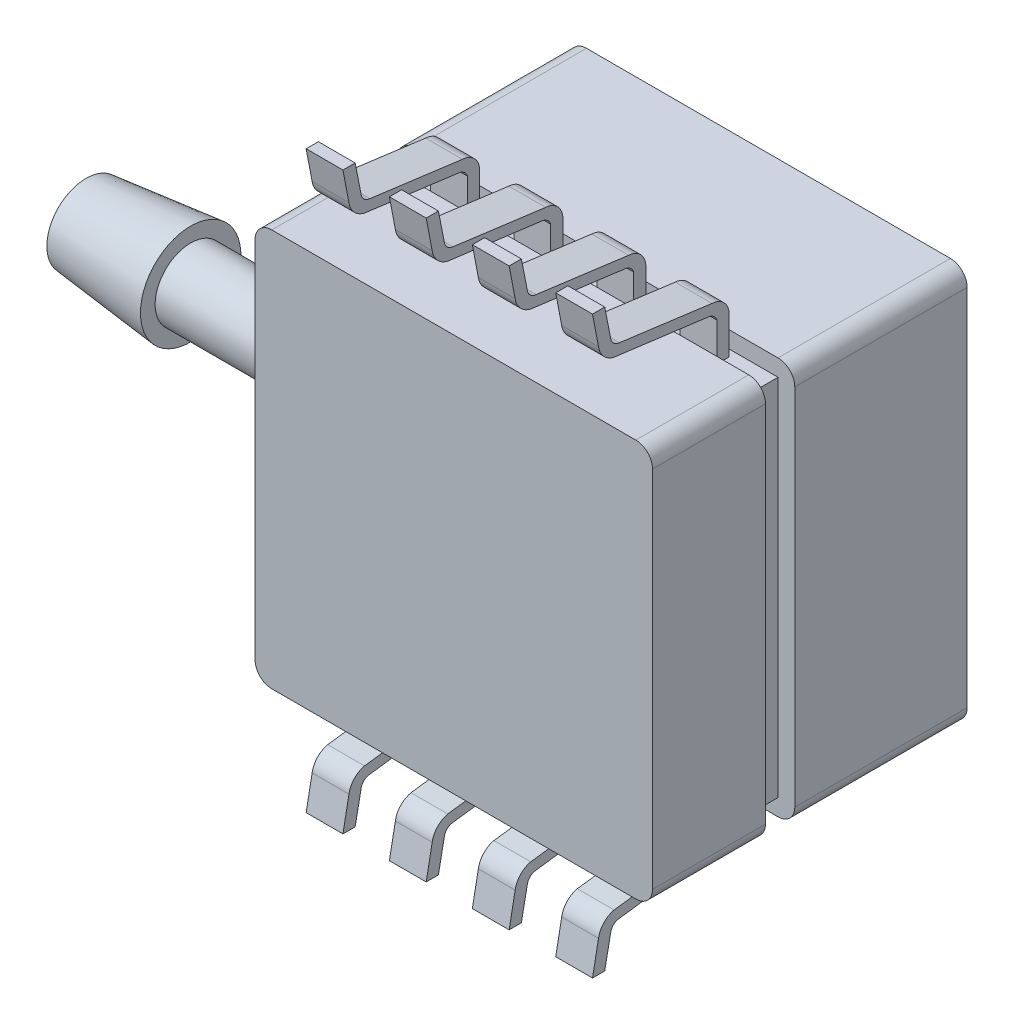
from build123d import *

# Parameters (mm, degrees)
SKETCH1_W             = 12.065
SKETCH1_H             = 12.065
BOSS_EXTRUDE1_DEPTH   = 9.5504
SKETCH3_W             = 0.508
SKETCH3_H             = 0.889
CUT_EXTRUDE1_DEPTH    = 17.527716763
SKETCH4_W             = 0.889
SKETCH4_H             = 0.508
CUT_EXTRUDE2_DEPTH    = 17.160614017
BOSS_EXTRUDE2_DEPTH   = 12.065
SKETCH6_W             = 2.010508142
SKETCH6_H             = 3.048
SKETCH6_W_2           = 1.413000982
SKETCH6_W_3           = 1.400656211
SKETCH6_W_4           = 1.409514657
SKETCH6_W_5           = 1.742646619
CUT_EXTRUDE3_DEPTH    = 15.300672912
SKETCH7_W             = 1.589030952
SKETCH7_H             = 0.369934407
SKETCH7_W_2           = 1.409514657
SKETCH7_W_3           = 1.400656211
SKETCH7_W_4           = 1.413000982
SKETCH7_W_5           = 1.782397198
CUT_EXTRUDE4_DEPTH    = 0.508
SKETCH8_W             = 1.589030952
SKETCH8_H             = 0.369934407
SKETCH8_W_2           = 1.409514657
SKETCH8_W_3           = 1.400656211
SKETCH8_W_4           = 1.413000982
SKETCH8_W_5           = 1.782397198
CUT_EXTRUDE5_DEPTH    = 0.508
FILLET1_R             = 0.508
SKETCH9_R             = 1.0795
SKETCH9_R_2           = 0.396875
BOSS_EXTRUDE3_DEPTH   = 3.175
SKETCH10_R            = 1.524
SKETCH10_R_2          = 0.396875
BOSS_EXTRUDE4_DEPTH   = 3.175
BOSS_EXTRUDE4_2_DEPTH = 3.175
CHAMFER1_SIZE         = 3.175
CHAMFER1_SIZE_2       = 0.333705947
CHAMFER2_SIZE         = 3.175
CHAMFER2_SIZE_2       = 0.333705947


with BuildPart() as part:
    # Sketch1 → Boss-Extrude1 (new body)
    with BuildSketch(Plane.XY):
        Rectangle(SKETCH1_W, SKETCH1_H)
    extrude(amount=BOSS_EXTRUDE1_DEPTH)

    # Sketch3 → Cut-Extrude1 (cut, through all)
    with BuildSketch(Plane(origin=(0, 6.0325, 0), x_dir=(1, 0, 0), z_dir=(0, 1, 0))):
        with Locations((-5.7785, -5.6769)):
            Rectangle(SKETCH3_W, SKETCH3_H)
        with Locations((5.7785, -5.6769)):
            Rectangle(SKETCH3_W, SKETCH3_H)
    extrude(amount=-CUT_EXTRUDE1_DEPTH, mode=Mode.SUBTRACT)

    # Sketch4 → Cut-Extrude2 (cut, through all)
    with BuildSketch(Plane(origin=(5.5245, 0, 0), x_dir=(0, 0, -1), z_dir=(1, 0, 0))):
        with Locations((-5.6769, 5.7785)):
            Rectangle(SKETCH4_W, SKETCH4_H)
        with Locations((-5.6769, -5.7785)):
            Rectangle(SKETCH4_W, SKETCH4_H)
    extrude(amount=-CUT_EXTRUDE2_DEPTH, mode=Mode.SUBTRACT)

    # Sketch5 → Boss-Extrude2 (add, through all)
    with BuildSketch(Plane(origin=(6.0325, 0, 0), x_dir=(0, 0, -1), z_dir=(1, 0, 0))):
        with BuildLine():
            ThreePointArc((-8.934627895, 7.265855746), (-9.249262248, 7.447228638), (-9.407747298, 7.773990618))
            Line((-9.407747298, 7.773990618), (-9.589412438, 8.72704753))
            Line((-9.589412438, 8.72704753), (-9.219352327, 8.72704753))
            Line((-9.219352327, 8.72704753), (-9.030957356, 7.773990618))
            ThreePointArc((-9.030957356, 7.773990618), (-8.934478337, 7.629789758), (-8.773302251, 7.565568589))
            Line((-8.773302251, 7.565568589), (-5.960764741, 7.193974625))
            ThreePointArc((-5.960764741, 7.193974625), (-5.591273278, 7.021604846), (-5.440761064, 6.642683921))
            Line((-5.440761064, 6.642683921), (-5.440761064, 5.5245))
            Line((-5.440761064, 5.5245), (-5.810695471, 5.5245))
            Line((-5.810695471, 5.5245), (-5.810695471, 6.676866964))
            ThreePointArc((-5.810695471, 6.676866964), (-5.915490425, 6.828747463), (-6.087415345, 6.895766048))
            Line((-6.087415345, 6.895766048), (-8.934627895, 7.265855746))
        make_face()
        with BuildLine():
            ThreePointArc((-5.440761064, -6.642683921), (-5.591273278, -7.021604846), (-5.960764741, -7.193974625))
            Line((-5.960764741, -7.193974625), (-8.773302251, -7.565568589))
            ThreePointArc((-8.773302251, -7.565568589), (-8.934478337, -7.629789758), (-9.030957356, -7.773990618))
            Line((-9.030957356, -7.773990618), (-9.219352327, -8.72704753))
            Line((-9.219352327, -8.72704753), (-9.589412438, -8.72704753))
            Line((-9.589412438, -8.72704753), (-9.407747298, -7.773990618))
            ThreePointArc((-9.407747298, -7.773990618), (-9.249262248, -7.447228638), (-8.934627895, -7.265855746))
            Line((-8.934627895, -7.265855746), (-6.087415345, -6.895766048))
            ThreePointArc((-6.087415345, -6.895766048), (-5.915490425, -6.828747463), (-5.810695471, -6.676866964))
            Line((-5.810695471, -6.676866964), (-5.810695471, -5.5245))
            Line((-5.810695471, -5.5245), (-5.440761064, -5.5245))
            Line((-5.440761064, -5.5245), (-5.440761064, -6.642683921))
        make_face()
    extrude(amount=-BOSS_EXTRUDE2_DEPTH)

    # Sketch6 → Cut-Extrude3 (cut, through all)
    with BuildSketch(Plane(origin=(0, 0, 0), x_dir=(-1, 0, 0), z_dir=(0, 0, -1))):
        with Locations((-5.255356873, 7.5565)):
            Rectangle(SKETCH6_W, SKETCH6_H)
        with Locations((-2.426002311, 7.5565)):
            Rectangle(SKETCH6_W_2, SKETCH6_H)
        with Locations((0.098426285, 7.5565)):
            Rectangle(SKETCH6_W_3, SKETCH6_H)
        with Locations((2.621111719, 7.5565)):
            Rectangle(SKETCH6_W_4, SKETCH6_H)
        with Locations((5.314792358, 7.5565)):
            Rectangle(SKETCH6_W_5, SKETCH6_H)
        with Locations((5.314792358, -7.5565)):
            Rectangle(SKETCH6_W_5, SKETCH6_H)
        with Locations((2.621111719, -7.5565)):
            Rectangle(SKETCH6_W_4, SKETCH6_H)
        with Locations((0.098426285, -7.5565)):
            Rectangle(SKETCH6_W_3, SKETCH6_H)
        with Locations((-2.426002311, -7.5565)):
            Rectangle(SKETCH6_W_2, SKETCH6_H)
        with Locations((-5.255356873, -7.5565)):
            Rectangle(SKETCH6_W, SKETCH6_H)
    extrude(amount=-CUT_EXTRUDE3_DEPTH, mode=Mode.SUBTRACT)

    # Sketch7 → Cut-Extrude4 (cut)
    with BuildSketch(Plane(origin=(0, 6.0325, 0), x_dir=(1, 0, 0), z_dir=(0, 1, 0))):
        with Locations((-5.237984524, -5.625728268)):
            Rectangle(SKETCH7_W, SKETCH7_H)
        with Locations((-2.621111719, -5.625728268)):
            Rectangle(SKETCH7_W_2, SKETCH7_H)
        with Locations((-0.098426285, -5.625728268)):
            Rectangle(SKETCH7_W_3, SKETCH7_H)
        with Locations((2.426002311, -5.625728268)):
            Rectangle(SKETCH7_W_4, SKETCH7_H)
        with Locations((5.141301401, -5.625728268)):
            Rectangle(SKETCH7_W_5, SKETCH7_H)
    extrude(amount=-CUT_EXTRUDE4_DEPTH, mode=Mode.SUBTRACT)

    # Sketch8 → Cut-Extrude5 (cut)
    with BuildSketch(Plane.XZ.offset(6.0325)):
        with Locations((-5.237984524, 5.625728268)):
            Rectangle(SKETCH8_W, SKETCH8_H)
        with Locations((-2.621111719, 5.625728268)):
            Rectangle(SKETCH8_W_2, SKETCH8_H)
        with Locations((-0.098426285, 5.625728268)):
            Rectangle(SKETCH8_W_3, SKETCH8_H)
        with Locations((2.426002311, 5.625728268)):
            Rectangle(SKETCH8_W_4, SKETCH8_H)
        with Locations((5.141301401, 5.625728268)):
            Rectangle(SKETCH8_W_5, SKETCH8_H)
    extrude(amount=-CUT_EXTRUDE5_DEPTH, mode=Mode.SUBTRACT)

    # Fillet1
    fillet1_edges = [part.edges().sort_by_distance(p)[0] for p in [
        (6.0325, 6.0325, 2.6162),
        (6.0325, 6.0325, 7.8359),
        (-6.0325, 6.0325, 7.8359),
        (-6.0325, 6.0325, 2.6162),
        (-6.0325, -6.0325, 7.8359),
        (-6.0325, -6.0325, 2.6162),
        (6.0325, -6.0325, 7.8359),
        (6.0325, -6.0325, 2.6162),
    ]]
    fillet(fillet1_edges, radius=FILLET1_R)

    # Sketch9 → Boss-Extrude3 (add)
    # profile 1 of 2: a face of its own
    with BuildSketch(Plane.ZY.offset(6.0325)):
        with Locations(Location((1.2192, -2.159, 0), (0, 0, 180))):
            Circle(SKETCH9_R)
        with Locations((1.2192, -2.159)):
            Circle(SKETCH9_R_2, mode=Mode.SUBTRACT)
    # profile 2 of 2: a face of its own
    with BuildSketch(Plane.ZY.offset(6.0325)):
        with Locations(Location((8.3312, 2.159, 0), (0, 0, 180))):
            Circle(SKETCH9_R)
        with Locations((8.3312, 2.159)):
            Circle(SKETCH9_R_2, mode=Mode.SUBTRACT)
    extrude(amount=BOSS_EXTRUDE3_DEPTH)


with BuildPart() as body_2:
    # Sketch10 → Boss-Extrude4 (new body)
    with BuildSketch(Plane.ZY.offset(9.2075)):
        with Locations((1.2192, -2.159)):
            Circle(SKETCH10_R)
        with Locations((1.2192, -2.159)):
            Circle(SKETCH10_R_2, mode=Mode.SUBTRACT)
    extrude(amount=BOSS_EXTRUDE4_DEPTH)

    # Chamfer2
    # the kernel refuses this chamfer: 3.175, 0.333705947 mm, written as the material it takes off along each edge
    with BuildSketch(Plane(origin=(-12.3825, -2.159, 1.2192), x_dir=(0, 0, 1), z_dir=(0, -1, 0))) as chamfer2_piece_1:
        Polygon((1.524, -CHAMFER2_SIZE), (1.524 - CHAMFER2_SIZE_2, 0), (1.524, 0), align=None)
    revolve(axis=Axis((-12.3825, -2.159, 1.2192), (-1, 0, 0)), mode=Mode.SUBTRACT)


with BuildPart() as body_3:
    # Sketch10 → Boss-Extrude4 2 (new body)
    with BuildSketch(Plane.ZY.offset(9.2075)):
        with Locations((8.3312, 2.159)):
            Circle(SKETCH10_R)
        with Locations((8.3312, 2.159)):
            Circle(SKETCH10_R_2, mode=Mode.SUBTRACT)
    extrude(amount=BOSS_EXTRUDE4_2_DEPTH)

    # Chamfer1
    # the kernel refuses this chamfer: 3.175, 0.333705947 mm, written as the material it takes off along each edge
    with BuildSketch(Plane(origin=(-12.3825, 2.159, 8.3312), x_dir=(0, 0, 1), z_dir=(0, -1, 0))) as chamfer1_piece_1:
        Polygon((1.524, -CHAMFER1_SIZE), (1.524 - CHAMFER1_SIZE_2, 0), (1.524, 0), align=None)
    revolve(axis=Axis((-12.3825, 2.159, 8.3312), (-1, 0, 0)), mode=Mode.SUBTRACT)


solid = Compound([part.part, body_2.part, body_3.part])
